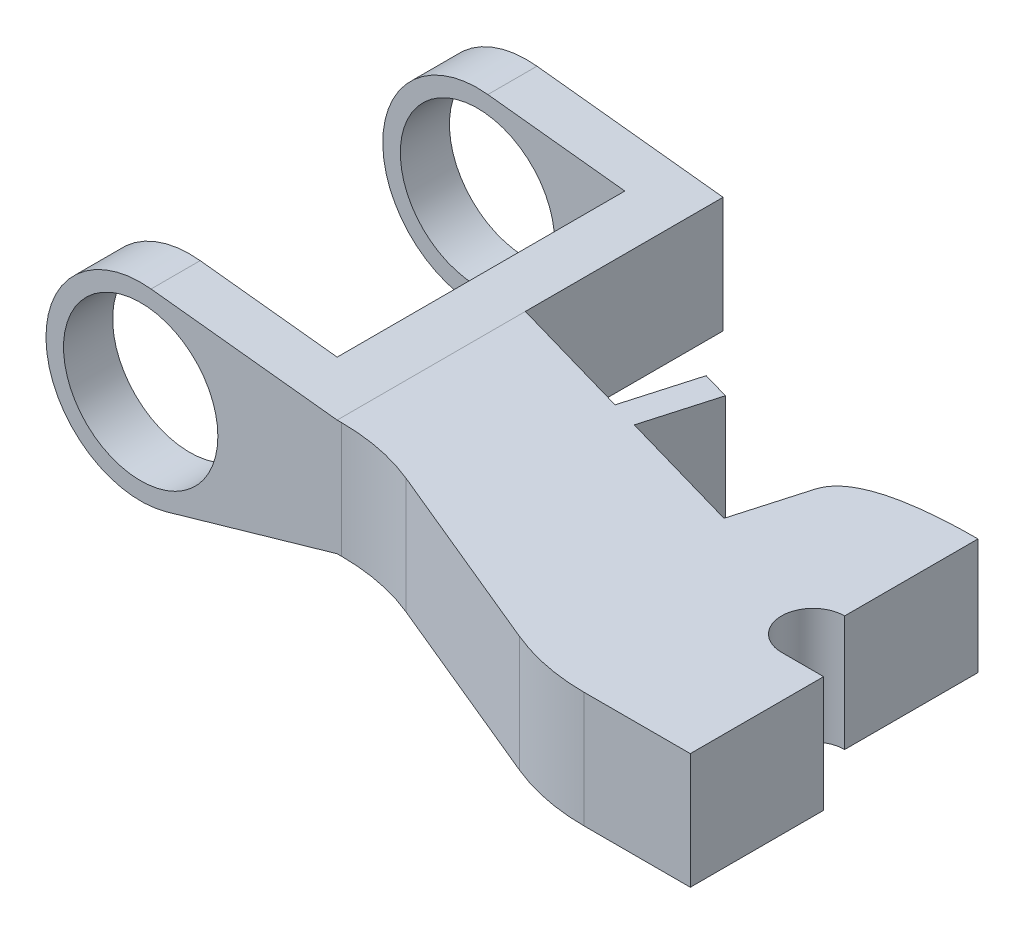
from build123d import *

# Parameters (mm, degrees)
EXTRUDE_1_DEPTH          = 13.5
CUT_EXTRUDE_1_DEPTH      = 136.073128486
CUT_EXTRUDE_1_DEPTH_BACK = 136.073128486
SKETCH_11_R              = 11
SKETCH_12_R              = 2.5
EXTRUDE_2_DEPTH          = 4.5
SKETCH_13_R              = 2.5
EXTRUDE_3_DEPTH          = 4.5
FILLET_1_R               = 30


with BuildPart() as part:
    # Эскиз10 → Бобышка-Вытянуть1 (new, symmetric)
    with BuildSketch(Plane(origin=(0, 0, 0), x_dir=(1, 0, 0), z_dir=(0, 1, 0))):
        with BuildLine():
            Line((-71.397339444, 6.5), (-52.083630945, -1.5))
            Line((-52.083630945, -1.5), (-32.769922446, -9.5))
            Line((-32.769922446, -9.5), (-11.66726189, -9.5))
            Line((-11.66726189, -9.5), (-11.66726189, 9.5))
            Line((-11.66726189, 9.5), (-17.66726189, 9.5))
            ThreePointArc((-17.66726189, 9.5), (-22.16726189, 14), (-17.66726189, 18.5))
            Line((-17.66726189, 18.5), (-17.66726189, 37.5))
            add(Edge.make_bspline(
                [(-35.41795442, 32.036211278), (-33.851238215, 37.5), (-17.66726189, 37.5)],
                knots=[0, 0, 0, 1, 1, 1], degree=2))
            Line((-35.41795442, 32.036211278), (-38.312146656, 21.942963471))
            Line((-38.312146656, 21.942963471), (-56.233549936, 27.081843168))
            Line((-56.233549936, 27.081843168), (-53.3393577, 37.175090975))
            Line((-53.3393577, 37.175090975), (-57.184404484, 38.277640398))
            Line((-57.184404484, 38.277640398), (-60.07859672, 28.184392591))
            Line((-60.07859672, 28.184392591), (-78, 33.323272288))
            Line((-78, 33.323272288), (-78, 61.5))
            Line((-78, 61.5), (-92.5, 61.5))
            Line((-92.5, 61.5), (-119.5, 61.5))
            Line((-119.5, 61.5), (-119.5, 54.5))
            Line((-119.5, 54.5), (-92.5, 54.5))
            Line((-92.5, 54.5), (-85, 54.5))
            Line((-85, 54.5), (-85, 13.5))
            Line((-85, 13.5), (-92.5, 13.5))
            Line((-92.5, 13.5), (-119.5, 13.5))
            Line((-119.5, 13.5), (-119.5, 6.5))
            Line((-119.5, 6.5), (-92.5, 6.5))
            Line((-92.5, 6.5), (-71.397339444, 6.5))
        make_face()
    extrude(amount=EXTRUDE_1_DEPTH, both=True)

    # Эскиз11 → Вырез-Вытянуть1 (cut, two sides: drawn at the far end of the back side and taken through both)
    with BuildSketch(Plane.XY.offset(-CUT_EXTRUDE_1_DEPTH_BACK)):
        with BuildLine():
            Line((-11.66726189, -13.5), (-11.66726189, -6))
            Line((-11.66726189, -6), (-78, -6))
            Line((-78, -6), (-102.271403318, -12.974882149))
            ThreePointArc((-102.271403318, -12.974882149), (-104.117303664, -13.368075946), (-106, -13.5))
            Line((-106, -13.5), (-11.66726189, -13.5))
        make_face()
        with BuildLine():
            Line((-78, 10.5), (-11.66726189, 10.5))
            Line((-11.66726189, 10.5), (-11.66726189, 13.5))
            Line((-11.66726189, 13.5), (-106, 13.5))
            ThreePointArc((-106, 13.5), (-105.260484121, 13.479729829), (-104.523188999, 13.418980187))
            Line((-104.523188999, 13.418980187), (-78, 10.5))
        make_face()
        with BuildLine():
            Line((-119.5, -13.5), (-106, -13.5))
            ThreePointArc((-106, -13.5), (-115.545941546, -9.545941546), (-119.5, 0))
            Line((-119.5, 0), (-119.5, -13.5))
        make_face()
        with BuildLine():
            ThreePointArc((-119.5, 0), (-115.545941546, 9.545941546), (-106, 13.5))
            Line((-106, 13.5), (-119.5, 13.5))
            Line((-119.5, 13.5), (-119.5, 0))
        make_face()
        with Locations((-106, 0)):
            Circle(SKETCH_11_R)
    extrude(amount=CUT_EXTRUDE_1_DEPTH + CUT_EXTRUDE_1_DEPTH_BACK, mode=Mode.SUBTRACT)

    # Эскиз12 → Бобышка-Вытянуть2 (add)
    with BuildSketch(Plane(origin=(-62.981794436, 0, -18.059738941), x_dir=(-0.2756373558168036, 0, 0.961261695938375), z_dir=(-0.961261695938375, 0, -0.2756373558168036))):
        with Locations((-18.53267148, 2.25)):
            Circle(SKETCH_12_R)
    extrude(amount=EXTRUDE_2_DEPTH)

    # Эскиз13 → Бобышка-Вытянуть3 (add)
    with BuildSketch(Plane(origin=(-41.215344372, 0, -11.818309821), x_dir=(-0.2756373558168751, 0, 0.9612616959383545), z_dir=(-0.9612616959383545, 0, -0.2756373558168751))):
        with Locations((-18.53267148, 2.25)):
            Circle(SKETCH_13_R)
    extrude(amount=EXTRUDE_3_DEPTH)

    # Скругление1
    fillet_1_edges = [part.edges().sort_by_distance(p)[0] for p in [
        (-32.769922446, 2.25, 9.5),
        (-71.397339444, 2.25, -6.5),
    ]]
    fillet(fillet_1_edges, radius=FILLET_1_R)


solid = part.part
